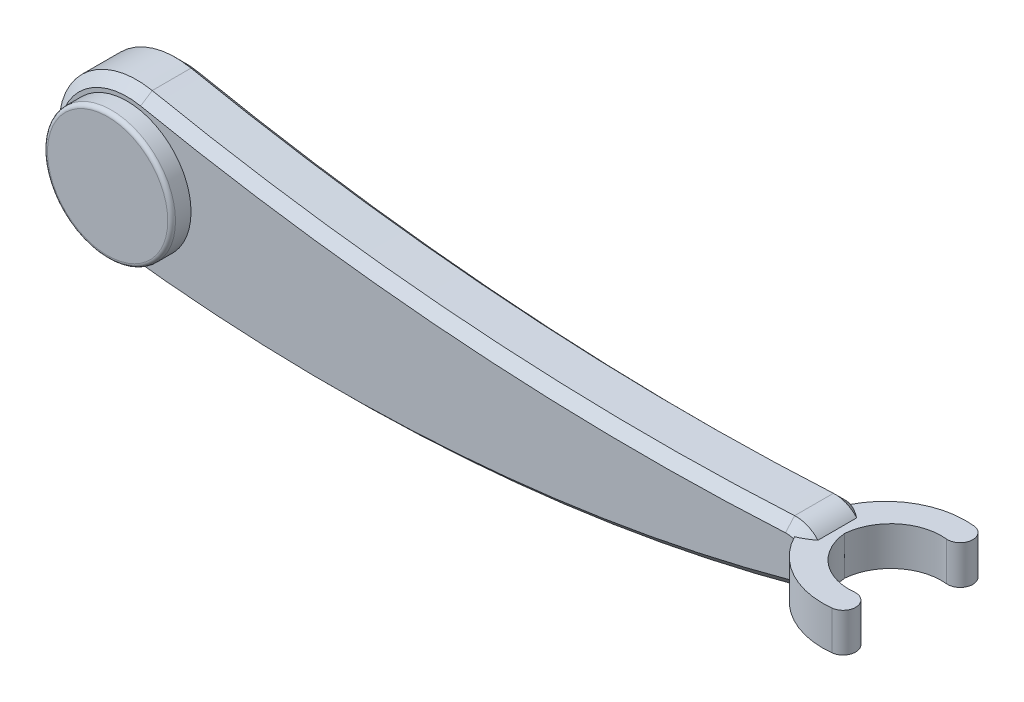
from build123d import *

# Parameters (mm, degrees)
BOSS_EXTRUDE1_DEPTH = 7.5
CHAMFER1_SIZE       = 2.5
SKETCH2_R           = 16.5
BOSS_EXTRUDE2_DEPTH = 5
BOSS_EXTRUDE3_START = -5
SKETCH3_R           = 16.5
BOSS_EXTRUDE3_DEPTH = 5
FILLET1_R           = 1
SKETCH5_R           = 5
BOSS_EXTRUDE4_DEPTH = 10
BOSS_EXTRUDE5_DEPTH = 5


with BuildPart() as part:
    # Sketch1 → Boss-Extrude1 (new, symmetric)
    with BuildSketch(Plane.XY):
        with BuildLine():
            ThreePointArc((84.587130955, 7.488627321), (1.402446099, 8.233773328), (-81.005816506, 19.597104332))
            ThreePointArc((-81.005816506, 19.597104332), (-104.737406765, 3.230290112), (-87.461525308, -19.847944306))
            ThreePointArc((-87.461525308, -19.847944306), (0.380210023, -22.09713345), (86.984359422, -7.232725467))
            ThreePointArc((86.984359422, -7.232725467), (92.402496368, 1.205424208), (84.587130955, 7.488627321))
        make_face()
    extrude(amount=BOSS_EXTRUDE1_DEPTH, both=True)

    # Chamfer1
    chamfer1_edges = [part.edges().sort_by_distance(p)[0] for p in [
        (92.402496368, 1.205424208, -7.5),
        (1.402446099, 8.233773328, -7.5),
        (-104.737406765, 3.230290112, -7.5),
        (0.380210023, -22.09713345, -7.5),
        (-104.737406765, 3.230290112, 7.5),
        (1.402446099, 8.233773328, 7.5),
        (92.402496368, 1.205424208, 7.5),
        (0.380210023, -22.09713345, 7.5),
    ]]
    chamfer(chamfer1_edges, length=CHAMFER1_SIZE)

    # Sketch2 → Boss-Extrude2 (add)
    with BuildSketch(Plane.XY.offset(7.5)):
        with Locations((-85, 0)):
            Circle(SKETCH2_R)
    extrude(amount=BOSS_EXTRUDE2_DEPTH)

    # Sketch3 → Boss-Extrude3 (add)
    with BuildSketch(Plane.XY.offset(12.5).offset(BOSS_EXTRUDE3_START)):
        with Locations((-85, 0)):
            Circle(SKETCH3_R)
        with BuildLine():
            ThreePointArc((-87.063800013, -0.552993547), (-87.488343777, -0.236721672), (-87.961871133, 0))
            Line((-87.961871133, 0), (-88.909676119, 0))
            ThreePointArc((-88.909676119, 0), (-88.554865966, 0.021055597), (-88.205036307, 0.083926829))
            ThreePointArc((-88.205036307, 0.083926829), (-88.551096111, 0.165020569), (-88.904318043, 0.204616638))
            Line((-88.904318043, 0.204616638), (-87.957811991, 0.155012358))
            ThreePointArc((-87.957811991, 0.155012358), (-87.416740514, 0.397857944), (-86.934015005, 0.742398803))
            ThreePointArc((-86.934015005, 0.742398803), (-87.062207135, 1.321448974), (-87.301806189, 1.863965899))
            Line((-87.301806189, 1.863965899), (-88.038389006, 2.460438904))
            ThreePointArc((-88.038389006, 2.460438904), (-87.749399013, 2.253512912), (-87.437964157, 2.082218099))
            ThreePointArc((-87.437964157, 2.082218099), (-87.655869193, 2.363022262), (-87.905455577, 2.616083952))
            Line((-87.905455577, 2.616083952), (-87.201099206, 1.981878627))
            ThreePointArc((-87.201099206, 1.981878627), (-86.690802086, 1.840945466), (-86.163677393, 1.791906047))
            ThreePointArc((-86.163677393, 1.791906047), (-85.994076204, 2.293404544), (-85.915268515, 2.816906841))
            Line((-85.915268515, 2.816906841), (-86.208156363, 3.718322949))
            ThreePointArc((-86.208156363, 3.718322949), (-86.078488934, 3.387384979), (-85.910591529, 3.074105482))
            ThreePointArc((-85.910591529, 3.074105482), (-85.94040516, 3.428287256), (-86.01189864, 3.776457135))
            Line((-86.01189864, 3.776457135), (-85.766588658, 2.860947821))
            ThreePointArc((-85.766588658, 2.860947821), (-85.3684285, 2.42140168), (-84.891580284, 2.06877142))
            ThreePointArc((-84.891580284, 2.06877142), (-84.380484393, 2.369625723), (-83.938560315, 2.765144915))
            Line((-83.938560315, 2.765144915), (-83.598897386, 3.649997098))
            ThreePointArc((-83.598897386, 3.649997098), (-83.706392879, 3.311207634), (-83.773065265, 2.962082477))
            ThreePointArc((-83.773065265, 2.962082477), (-83.573340995, 3.256095739), (-83.40979146, 3.571666859))
            Line((-83.40979146, 3.571666859), (-83.795298478, 2.705803919))
            ThreePointArc((-83.795298478, 2.705803919), (-83.771643397, 2.176931776), (-83.655392168, 1.660452388))
            ThreePointArc((-83.655392168, 1.660452388), (-83.126029104, 1.654123631), (-82.603795919, 1.740944171))
            Line((-82.603795919, 1.740944171), (-81.837005578, 2.298049964))
            ThreePointArc((-81.837005578, 2.298049964), (-82.111676851, 2.072463453), (-82.357740207, 1.815974843))
            ThreePointArc((-82.357740207, 1.815974843), (-82.030106241, 1.953777479), (-81.721069709, 2.129362228))
            Line((-81.721069709, 2.129362228), (-82.515965855, 1.613150636))
            ThreePointArc((-82.515965855, 1.613150636), (-82.810960821, 1.098650595), (-82.998977926, 0.536172249))
            ThreePointArc((-82.998977926, 0.536172249), (-82.554911164, 0.143060264), (-82.042188009, -0.155012358))
            Line((-82.042188009, -0.155012358), (-81.095681957, -0.204616638))
            ThreePointArc((-81.095681957, -0.204616638), (-81.451107819, -0.207074051), (-81.803748474, -0.251550451))
            ThreePointArc((-81.803748474, -0.251550451), (-81.462407052, -0.350644424), (-81.111741496, -0.408672437))
            Line((-81.111741496, -0.408672437), (-82.054354307, -0.309599838))
            ThreePointArc((-82.054354307, -0.309599838), (-82.550031783, -0.495527637), (-83.005309265, -0.765690034))
            ThreePointArc((-83.005309265, -0.765690034), (-82.847746089, -1.271099919), (-82.603795919, -1.740944171))
            Line((-82.603795919, -1.740944171), (-81.837005578, -2.298049964))
            ThreePointArc((-81.837005578, -2.298049964), (-82.13642919, -2.106532125), (-82.456402112, -1.951771306))
            ThreePointArc((-82.456402112, -1.951771306), (-82.224099554, -2.220786368), (-81.961610994, -2.460438904))
            Line((-81.961610994, -2.460438904), (-82.698193811, -1.863965899))
            ThreePointArc((-82.698193811, -1.863965899), (-83.278670885, -1.742398271), (-83.871720062, -1.737398746))
            ThreePointArc((-83.871720062, -1.737398746), (-84.1083676, -2.281209618), (-84.233411342, -2.860947821))
            Line((-84.233411342, -2.860947821), (-83.98810136, -3.776457135))
            ThreePointArc((-83.98810136, -3.776457135), (-84.10027113, -3.439186435), (-84.251542655, -3.117549205))
            ThreePointArc((-84.251542655, -3.117549205), (-84.240306325, -3.472805911), (-84.187132628, -3.824240315))
            Line((-84.187132628, -3.824240315), (-84.384192365, -2.897147142))
            ThreePointArc((-84.384192365, -2.897147142), (-84.714192974, -2.483184699), (-85.111821161, -2.133674854))
            ThreePointArc((-85.111821161, -2.133674854), (-85.543804826, -2.439706584), (-85.915268515, -2.816906841))
            Line((-85.915268515, -2.816906841), (-86.208156363, -3.718322949))
            ThreePointArc((-86.208156363, -3.718322949), (-86.118539059, -3.374371905), (-86.070229845, -3.022235848))
            ThreePointArc((-86.070229845, -3.022235848), (-86.254292934, -3.326298936), (-86.401102614, -3.649997098))
            Line((-86.401102614, -3.649997098), (-86.061439685, -2.765144915))
            ThreePointArc((-86.061439685, -2.765144915), (-86.12519928, -2.175511948), (-86.303706723, -1.609943726))
            ThreePointArc((-86.303706723, -1.609943726), (-86.894029708, -1.552925343), (-87.484034145, -1.613150636))
            Line((-87.484034145, -1.613150636), (-88.278930291, -2.129362228))
            ThreePointArc((-88.278930291, -2.129362228), (-87.992829159, -1.91846006), (-87.733679448, -1.67520092))
            ThreePointArc((-87.733679448, -1.67520092), (-88.068076435, -1.795667665), (-88.385878839, -1.954838059))
            Line((-88.385878839, -1.954838059), (-87.565055644, -1.480935566))
            ThreePointArc((-87.565055644, -1.480935566), (-87.27332976, -1.039164907), (-87.063800013, -0.552993547))
        make_face(mode=Mode.SUBTRACT)
    extrude(amount=BOSS_EXTRUDE3_DEPTH)

    # Fillet1
    fillet1_edges = [part.edges().sort_by_distance(p)[0] for p in [
        (-101.5, 0, 12.5),
    ]]
    fillet(fillet1_edges, radius=FILLET1_R)

    # Sketch5 → Boss-Extrude4 (add)
    with BuildSketch(Plane(origin=(0, 0, -7.5), x_dir=(-1, 0, 0), z_dir=(0, 0, -1))):
        with Locations((85, 0)):
            Circle(SKETCH5_R)
    extrude(amount=BOSS_EXTRUDE4_DEPTH)

    # Sketch6 → Boss-Extrude5 (add, symmetric)
    with BuildSketch(Plane(origin=(0, 0, 0), x_dir=(1, 0, 0), z_dir=(0, 1, 0))):
        with BuildLine():
            ThreePointArc((92.5, 0), (97.193109444, 8.92924071), (106.84517018, 11.860851101))
            ThreePointArc((106.84517018, 11.860851101), (110.404097524, 14.750693323), (107.530311187, 18.322598137))
            ThreePointArc((107.530311187, 18.322598137), (92.271326036, 13.903797171), (84.587130955, 0))
            ThreePointArc((84.587130955, 0), (92.271326036, -13.903797171), (107.530311187, -18.322598137))
            ThreePointArc((107.530311187, -18.322598137), (110.404097524, -14.750693323), (106.84517018, -11.860851101))
            ThreePointArc((106.84517018, -11.860851101), (97.193109444, -8.92924071), (92.5, 0))
        make_face()
    extrude(amount=BOSS_EXTRUDE5_DEPTH, both=True)


solid = part.part
